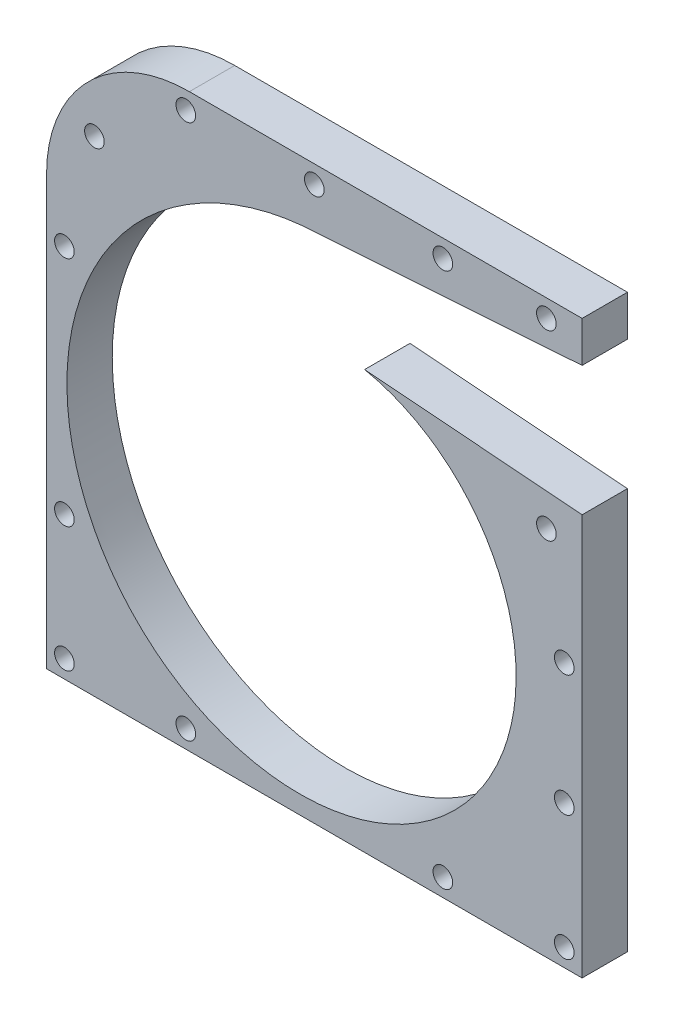
from build123d import *

# Parameters (mm, degrees)
SKETCH1_W           = 150
SKETCH1_H           = 160
BOSS_EXTRUDE1_DEPTH = 12.7
CUT_EXTRUDE2_REACH  = 203.761
SKETCH2_R           = 50.75
CUT_EXTRUDE3_REACH  = 203.761
FILLET1_R           = 40
CUT_EXTRUDE4_REACH  = 203.761
SKETCH9_R           = 2.75


with BuildPart() as part:
    # Sketch1 → Boss-Extrude1 (new body)
    with BuildSketch(Plane.XY):
        with Locations((56.818174671, 72.21769967)):
            Rectangle(SKETCH1_W, SKETCH1_H)
    extrude(amount=BOSS_EXTRUDE1_DEPTH)

    # Sketch2 → Cut-Extrude2 (cut, up to next)
    with BuildSketch(Plane.XY, mode=Mode.PRIVATE) as cut_extrude2_sk1:
        with Locations((56.818174671, 60.21769967)):
            Circle(SKETCH2_R)
    cut_extrude2_tool1 = extrude(cut_extrude2_sk1.sketch, amount=CUT_EXTRUDE2_REACH, mode=Mode.PRIVATE) & part.part
    add(cut_extrude2_tool1.solids().sort_by_distance((56.818175, 60.2177, 0))[0], mode=Mode.SUBTRACT)

    # Sketch8 → Cut-Extrude3 (cut, up to next)
    with BuildSketch(Plane.XY.offset(12.7), mode=Mode.PRIVATE) as cut_extrude3_sk1:
        with BuildLine():
            Line((58.931733711, 135.884282717), (131.818174671, 140.809388743))
            Line((131.818174671, 140.809388743), (131.818174671, 104.578808843))
            Line((131.818174671, 104.578808843), (70.908782711, 109.357489671))
            add(Edge.make_bspline(
                [(70.908782711, 109.357489671), (74.066889939, 108.718233651), (77.187896264, 107.773738498), (83.238807144, 105.290817785), (86.168565222, 103.752406014), (91.723508544, 100.120752075), (94.348550883, 98.027552137), (99.188672135, 93.347162402), (101.403617241, 90.760042381), (105.330406174, 85.172708949), (107.042130601, 82.172590891), (109.885411693, 75.857728145), (111.016868247, 72.543101399), (112.641929822, 65.712046234), (113.135458279, 62.195754428), (113.449028739, 55.084717758), (113.26902119, 51.49012346), (112.223838007, 44.35202718), (111.358642349, 40.808684362), (108.956407144, 33.904165691), (107.41937855, 30.543151797), (103.711948195, 24.131054935), (101.541588676, 21.080130687), (96.630315911, 15.407832385), (93.889475328, 12.786607763), (87.922680517, 8.080537394), (84.696827336, 5.995825962), (77.865453296, 2.452541319), (74.260058722, 0.994081919), (66.791630366, -1.227751149), (62.928743935, -1.991036235), (55.079821042, -2.777438749), (51.093947944, -2.800496703), (43.141320267, -2.087463755), (39.174739306, -1.351345355), (31.405665873, 0.871605986), (27.603351006, 2.358432727), (20.305187809, 6.046625862), (16.809514525, 8.247951859), (10.259104984, 13.301926307), (7.204534629, 16.15450094), (1.657753905, 22.42243066), (-0.834306084, 25.837680551), (-5.152459557, 33.119788397), (-6.97842411, 36.986513039), (-9.882808968, 45.041359138), (-10.961127035, 49.22932354), (-12.314157301, 57.781772746), (-12.588798304, 62.146082103), (-12.306546583, 70.896689041), (-11.749616984, 75.282798923), (-9.8060628, 83.91829096), (-8.419437722, 88.167479881), (-4.848665308, 96.371971087), (-2.66455461, 100.32708166), (2.439222898, 107.793616398), (5.358816558, 111.304857506), (11.843451019, 117.746862185), (15.408384147, 120.677458302), (23.068167194, 125.839675154), (27.162878227, 128.071150539), (35.744977915, 131.739638392), (40.232201003, 133.176533415), (49.444962438, 135.187347231), (54.170314143, 135.761181358), (58.931733711, 135.884282717)],
                knots=[0, 0, 0, 0, 0.03125, 0.03125, 0.0625, 0.0625, 0.09375, 0.09375, 0.125, 0.125, 0.15625, 0.15625, 0.1875, 0.1875, 0.21875, 0.21875, 0.25, 0.25, 0.28125, 0.28125, 0.3125, 0.3125, 0.34375, 0.34375, 0.375, 0.375, 0.40625, 0.40625, 0.4375, 0.4375, 0.46875, 0.46875, 0.5, 0.5, 0.53125, 0.53125, 0.5625, 0.5625, 0.59375, 0.59375, 0.625, 0.625, 0.65625, 0.65625, 0.6875, 0.6875, 0.71875, 0.71875, 0.75, 0.75, 0.78125, 0.78125, 0.8125, 0.8125, 0.84375, 0.84375, 0.875, 0.875, 0.90625, 0.90625, 0.9375, 0.9375, 0.96875, 0.96875, 1, 1, 1, 1], degree=3))
        make_face()
    cut_extrude3_tool1 = extrude(cut_extrude3_sk1.sketch, amount=-CUT_EXTRUDE3_REACH, mode=Mode.PRIVATE) & part.part
    add(cut_extrude3_tool1.solids().sort_by_distance((56.155485, 70.818563, 12.7))[0], mode=Mode.SUBTRACT)

    # Fillet1
    fillet1_edges = [part.edges().sort_by_distance(p)[0] for p in [
        (-18.181825329, 152.21769967, 6.35),
    ]]
    fillet(fillet1_edges, radius=FILLET1_R)

    # Sketch9 → Cut-Extrude4 (cut, up to next)
    with BuildSketch(Plane.XY.offset(12.7), mode=Mode.PRIVATE) as cut_extrude4_sk1:
        with Locations((121.818174671, 147.21769967)):
            Circle(SKETCH9_R)
    cut_extrude4_tool1 = extrude(cut_extrude4_sk1.sketch, amount=-CUT_EXTRUDE4_REACH, mode=Mode.PRIVATE) & part.part
    # Sketch9 → Cut-Extrude4 (cut, up to next)
    with BuildSketch(Plane.XY.offset(12.7), mode=Mode.PRIVATE) as cut_extrude4_sk2:
        with Locations((92.818174671, 147.21769967)):
            Circle(SKETCH9_R)
    cut_extrude4_tool2 = extrude(cut_extrude4_sk2.sketch, amount=-CUT_EXTRUDE4_REACH, mode=Mode.PRIVATE) & part.part
    # Sketch9 → Cut-Extrude4 (cut, up to next)
    with BuildSketch(Plane.XY.offset(12.7), mode=Mode.PRIVATE) as cut_extrude4_sk3:
        with Locations((56.818174671, 147.21769967)):
            Circle(SKETCH9_R)
    cut_extrude4_tool3 = extrude(cut_extrude4_sk3.sketch, amount=-CUT_EXTRUDE4_REACH, mode=Mode.PRIVATE) & part.part
    # Sketch9 → Cut-Extrude4 (cut, up to next)
    with BuildSketch(Plane.XY.offset(12.7), mode=Mode.PRIVATE) as cut_extrude4_sk4:
        with Locations((20.818174671, 147.21769967)):
            Circle(SKETCH9_R)
    cut_extrude4_tool4 = extrude(cut_extrude4_sk4.sketch, amount=-CUT_EXTRUDE4_REACH, mode=Mode.PRIVATE) & part.part
    # Sketch9 → Cut-Extrude4 (cut, up to next)
    with BuildSketch(Plane.XY.offset(12.7), mode=Mode.PRIVATE) as cut_extrude4_sk5:
        with Locations((-4.774596198, 128.093555907)):
            Circle(SKETCH9_R)
    cut_extrude4_tool5 = extrude(cut_extrude4_sk5.sketch, amount=-CUT_EXTRUDE4_REACH, mode=Mode.PRIVATE) & part.part
    # Sketch9 → Cut-Extrude4 (cut, up to next)
    with BuildSketch(Plane.XY.offset(12.7), mode=Mode.PRIVATE) as cut_extrude4_sk6:
        with Locations((-13.181825329, 97.21769967)):
            Circle(SKETCH9_R)
    cut_extrude4_tool6 = extrude(cut_extrude4_sk6.sketch, amount=-CUT_EXTRUDE4_REACH, mode=Mode.PRIVATE) & part.part
    # Sketch9 → Cut-Extrude4 (cut, up to next)
    with BuildSketch(Plane.XY.offset(12.7), mode=Mode.PRIVATE) as cut_extrude4_sk7:
        with Locations((-13.181825329, 32.21769967)):
            Circle(SKETCH9_R)
    cut_extrude4_tool7 = extrude(cut_extrude4_sk7.sketch, amount=-CUT_EXTRUDE4_REACH, mode=Mode.PRIVATE) & part.part
    # Sketch9 → Cut-Extrude4 (cut, up to next)
    with BuildSketch(Plane.XY.offset(12.7), mode=Mode.PRIVATE) as cut_extrude4_sk8:
        with Locations((-13.181825329, -2.78230033)):
            Circle(SKETCH9_R)
    cut_extrude4_tool8 = extrude(cut_extrude4_sk8.sketch, amount=-CUT_EXTRUDE4_REACH, mode=Mode.PRIVATE) & part.part
    # Sketch9 → Cut-Extrude4 (cut, up to next)
    with BuildSketch(Plane.XY.offset(12.7), mode=Mode.PRIVATE) as cut_extrude4_sk9:
        with Locations((20.818174671, -2.78230033)):
            Circle(SKETCH9_R)
    cut_extrude4_tool9 = extrude(cut_extrude4_sk9.sketch, amount=-CUT_EXTRUDE4_REACH, mode=Mode.PRIVATE) & part.part
    # Sketch9 → Cut-Extrude4 (cut, up to next)
    with BuildSketch(Plane.XY.offset(12.7), mode=Mode.PRIVATE) as cut_extrude4_sk10:
        with Locations((92.818174671, -2.78230033)):
            Circle(SKETCH9_R)
    cut_extrude4_tool10 = extrude(cut_extrude4_sk10.sketch, amount=-CUT_EXTRUDE4_REACH, mode=Mode.PRIVATE) & part.part
    # Sketch9 → Cut-Extrude4 (cut, up to next)
    with BuildSketch(Plane.XY.offset(12.7), mode=Mode.PRIVATE) as cut_extrude4_sk11:
        with Locations((126.818174671, -2.78230033)):
            Circle(SKETCH9_R)
    cut_extrude4_tool11 = extrude(cut_extrude4_sk11.sketch, amount=-CUT_EXTRUDE4_REACH, mode=Mode.PRIVATE) & part.part
    # Sketch9 → Cut-Extrude4 (cut, up to next)
    with BuildSketch(Plane.XY.offset(12.7), mode=Mode.PRIVATE) as cut_extrude4_sk12:
        with Locations((126.818174671, 32.21769967)):
            Circle(SKETCH9_R)
    cut_extrude4_tool12 = extrude(cut_extrude4_sk12.sketch, amount=-CUT_EXTRUDE4_REACH, mode=Mode.PRIVATE) & part.part
    # Sketch9 → Cut-Extrude4 (cut, up to next)
    with BuildSketch(Plane.XY.offset(12.7), mode=Mode.PRIVATE) as cut_extrude4_sk13:
        with Locations((126.818174671, 66.21769967)):
            Circle(SKETCH9_R)
    cut_extrude4_tool13 = extrude(cut_extrude4_sk13.sketch, amount=-CUT_EXTRUDE4_REACH, mode=Mode.PRIVATE) & part.part
    # Sketch9 → Cut-Extrude4 (cut, up to next)
    with BuildSketch(Plane.XY.offset(12.7), mode=Mode.PRIVATE) as cut_extrude4_sk14:
        with Locations((121.818174671, 96.21769967)):
            Circle(SKETCH9_R)
    cut_extrude4_tool14 = extrude(cut_extrude4_sk14.sketch, amount=-CUT_EXTRUDE4_REACH, mode=Mode.PRIVATE) & part.part
    add(cut_extrude4_tool1.solids().sort_by_distance((121.818175, 147.2177, 12.7))[0], mode=Mode.SUBTRACT)
    add(cut_extrude4_tool2.solids().sort_by_distance((92.818175, 147.2177, 12.7))[0], mode=Mode.SUBTRACT)
    add(cut_extrude4_tool3.solids().sort_by_distance((56.818175, 147.2177, 12.7))[0], mode=Mode.SUBTRACT)
    add(cut_extrude4_tool4.solids().sort_by_distance((20.818175, 147.2177, 12.7))[0], mode=Mode.SUBTRACT)
    add(cut_extrude4_tool5.solids().sort_by_distance((-4.774596, 128.093556, 12.7))[0], mode=Mode.SUBTRACT)
    add(cut_extrude4_tool6.solids().sort_by_distance((-13.181825, 97.2177, 12.7))[0], mode=Mode.SUBTRACT)
    add(cut_extrude4_tool7.solids().sort_by_distance((-13.181825, 32.2177, 12.7))[0], mode=Mode.SUBTRACT)
    add(cut_extrude4_tool8.solids().sort_by_distance((-13.181825, -2.7823, 12.7))[0], mode=Mode.SUBTRACT)
    add(cut_extrude4_tool9.solids().sort_by_distance((20.818175, -2.7823, 12.7))[0], mode=Mode.SUBTRACT)
    add(cut_extrude4_tool10.solids().sort_by_distance((92.818175, -2.7823, 12.7))[0], mode=Mode.SUBTRACT)
    add(cut_extrude4_tool11.solids().sort_by_distance((126.818175, -2.7823, 12.7))[0], mode=Mode.SUBTRACT)
    add(cut_extrude4_tool12.solids().sort_by_distance((126.818175, 32.2177, 12.7))[0], mode=Mode.SUBTRACT)
    add(cut_extrude4_tool13.solids().sort_by_distance((126.818175, 66.2177, 12.7))[0], mode=Mode.SUBTRACT)
    add(cut_extrude4_tool14.solids().sort_by_distance((121.818175, 96.2177, 12.7))[0], mode=Mode.SUBTRACT)


solid = part.part
